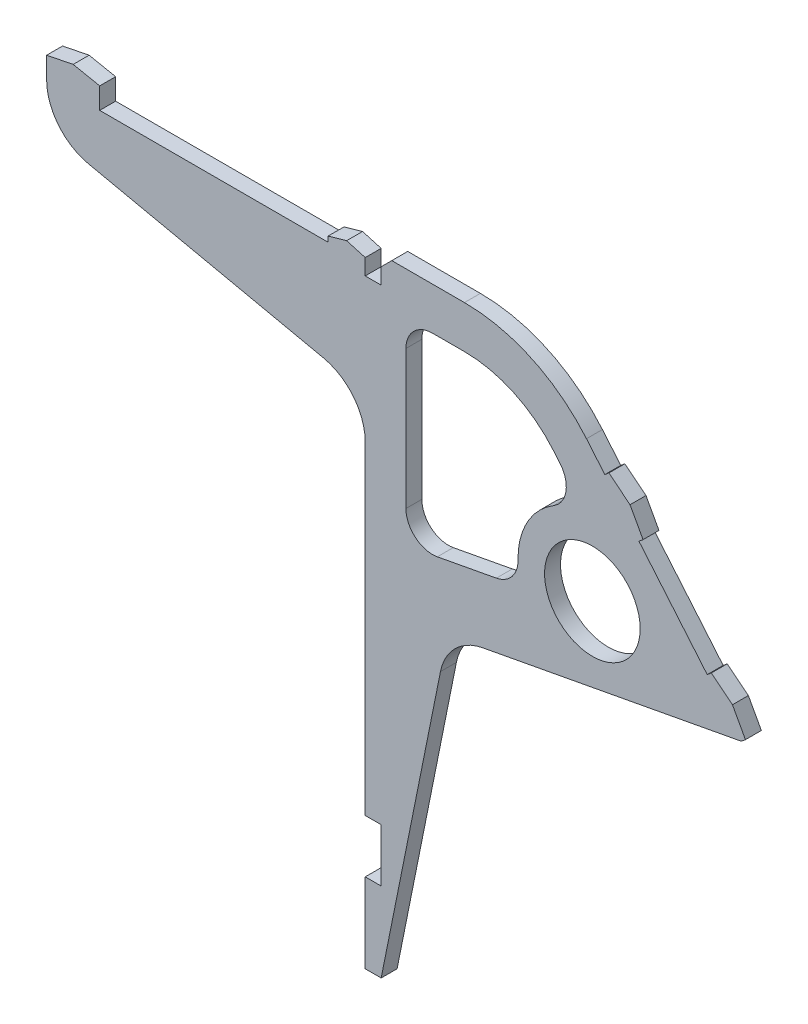
from build123d import *

# Parameters (mm, degrees)
SZKIC1_R                    = 9
DODANIE_WYCI_GNI_CIE1_DEPTH = 3


with BuildPart() as part:
    # Szkic1 → Dodanie-wyciągnięcie1 (new body)
    with BuildSketch(Plane.XY):
        with BuildLine():
            Line((-39.775892983, -56.342062001), (-42.775892983, -56.342062001))
            Line((-42.775892983, -56.342062001), (-42.775892983, 4.587225162))
            ThreePointArc((-42.775892983, 4.587225162), (-44.996156627, 10.870194383), (-50.67103343, 14.363193977))
            Line((-50.67103343, 14.363193977), (-94.880752536, 23.881969185))
            ThreePointArc((-94.880752536, 23.881969185), (-100.555629339, 27.374968778), (-102.775892983, 33.657937999))
            Line((-102.775892983, 33.657937999), (-102.775892983, 37.657937999))
            Line((-102.775892983, 37.657937999), (-97.775892983, 38.657937999))
            Line((-97.775892983, 38.657937999), (-92.775892983, 37.657937999))
            Line((-92.775892983, 37.657937999), (-92.775892983, 33.657937999))
            Line((-92.775892983, 33.657937999), (-49.775892983, 33.657937999))
            Line((-49.775892983, 33.657937999), (-49.775892983, 34.657937999))
            Line((-49.775892983, 34.657937999), (-46.275892983, 35.657937999))
            Line((-46.275892983, 35.657937999), (-42.775892983, 34.657937999))
            Line((-42.775892983, 34.657937999), (-42.775892983, 31.657937999))
            Line((-42.775892983, 31.657937999), (-39.775892983, 31.657937999))
            Line((-39.775892983, 31.657937999), (-39.775892983, 34.657937999))
            Line((-39.775892983, 34.657937999), (-37.775892983, 36.657937999))
            Line((-37.775892983, 36.657937999), (-24.089628922, 36.657937999))
            ThreePointArc((-24.089628922, 36.657937999), (-11.41108107, 33.847171611), (-1.108295629, 25.94156629))
            Line((-1.108295629, 25.94156629), (2.347208016, 21.823457404))
            Line((2.347208016, 21.823457404), (3.116168747, 22.46869207))
            Line((3.116168747, 22.46869207), (7.096151239, 19.281257464))
            Line((7.096151239, 19.281257464), (9.544044844, 14.808247639))
            Line((9.544044844, 14.808247639), (8.775084115, 14.163012974))
            Line((8.775084115, 14.163012974), (21.630836308, -1.157875888))
            Line((21.630836308, -1.157875888), (22.399797039, -0.512641223))
            Line((22.399797039, -0.512641223), (26.379779531, -3.700075828))
            Line((26.379779531, -3.700075828), (28.827673136, -8.173085654))
            Line((28.827673136, -8.173085654), (28.058712405, -8.81832032))
            Line((28.058712405, -8.81832032), (-20.641865184, -17.926074244))
            ThreePointArc((-20.641865184, -17.926074244), (-25.826752352, -20.637014525), (-28.607450297, -25.784826788))
            Line((-28.607450297, -25.784826788), (-39.775892638, -81.342061897))
            Line((-39.775892638, -81.342061897), (-42.775892983, -81.342062001))
            Line((-42.775892983, -81.342062001), (-42.775892983, -66.342062001))
            Line((-42.775892983, -66.342062001), (-39.775892983, -66.342062001))
            Line((-39.775892983, -66.342062001), (-39.775892983, -56.342062001))
        make_face()
        Circle(SZKIC1_R, mode=Mode.SUBTRACT)
        with BuildLine():
            Line((-35.113699725, -2.443177095), (-35.113699725, 23.657937999))
            ThreePointArc((-35.113699725, 23.657937999), (-33.649233631, 27.193471905), (-30.113699725, 28.657937999))
            Line((-30.113699725, 28.657937999), (-24.089628922, 28.657937999))
            ThreePointArc((-24.089628922, 28.657937999), (-14.792027164, 26.596709314), (-7.236651174, 20.799265413))
            Line((-7.236651174, 20.799265413), (-6.082128157, 19.42335846))
            ThreePointArc((-6.082128157, 19.42335846), (-4.977744091, 15.403405002), (-7.303837117, 11.943783461))
            ThreePointArc((-7.303837117, 11.943783461), (-12.276791246, 6.729071014), (-13.997429283, -0.268278729))
            ThreePointArc((-13.997429283, -0.268278729), (-15.119284844, -3.521166526), (-18.077369812, -5.278884435))
            Line((-18.077369812, -5.278884435), (-29.194558368, -7.357968969))
            ThreePointArc((-29.194558368, -7.357968969), (-33.307779656, -6.289974905), (-35.113699725, -2.443177095))
        make_face(mode=Mode.SUBTRACT)
    extrude(amount=DODANIE_WYCI_GNI_CIE1_DEPTH)


solid = part.part
